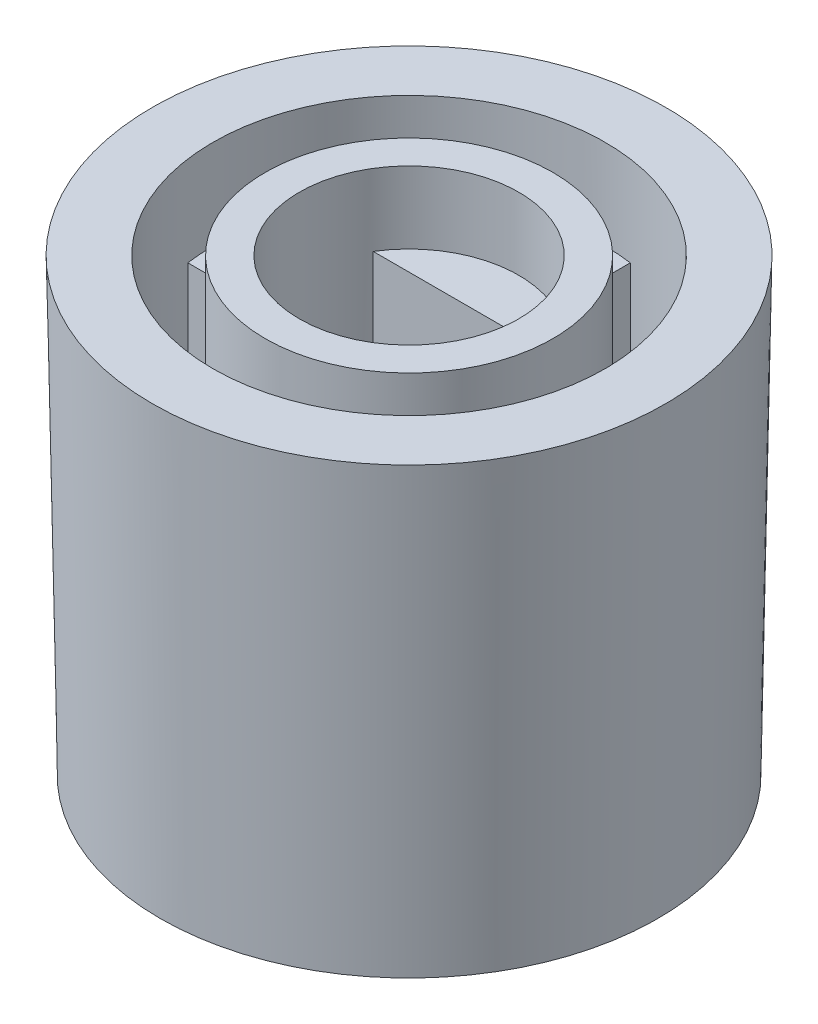
from build123d import *

# Parameters (mm, degrees)
SKETCH1_R           = 6.95
BOSS_EXTRUDE1_DEPTH = 2
SKETCH2_R           = 6.95
SKETCH2_R_2         = 5.45
BOSS_EXTRUDE2_DEPTH = 10.5
DRAFT1_ANGLE        = -1
SKETCH6_R           = 4
BOSS_EXTRUDE3_DEPTH = 10.5
CUT_EXTRUDE1_DEPTH  = 9
SKETCH7_R           = 3.05
CUT_EXTRUDE2_DEPTH  = 2
SKETCH8_W           = 2.525210291
SKETCH8_H           = 1.5
SKETCH8_W_2         = 2.122251202
SKETCH8_W_3         = 1.5
SKETCH8_H_2         = 2.337162717
SKETCH8_H_3         = 2.758031098
BOSS_EXTRUDE4_DEPTH = 8


with BuildPart() as part:
    # Sketch1 → Boss-Extrude1 (new body)
    with BuildSketch(Plane(origin=(0, 0, 0), x_dir=(1, 0, 0), z_dir=(0, 1, 0))):
        Circle(SKETCH1_R)
    extrude(amount=BOSS_EXTRUDE1_DEPTH)

    # Sketch2 → Boss-Extrude2 (add)
    with BuildSketch(Plane(origin=(0, 2, 0), x_dir=(1, 0, 0), z_dir=(0, 1, 0))):
        Circle(SKETCH2_R)
        Circle(SKETCH2_R_2, mode=Mode.SUBTRACT)
    extrude(amount=BOSS_EXTRUDE2_DEPTH)

    # Draft1
    draft1_faces = [part.faces().sort_by_distance(p)[0] for p in [
        (-6.95, 6.25, 0),
    ]]
    draft(draft1_faces, Plane.ZX.offset(2), DRAFT1_ANGLE)

    # Sketch6 → Boss-Extrude3 (add)
    with BuildSketch(Plane(origin=(0, 2, 0), x_dir=(1, 0, 0), z_dir=(0, 1, 0))):
        Circle(SKETCH6_R)
    extrude(amount=BOSS_EXTRUDE3_DEPTH)

    # Sketch5 → Cut-Extrude1 (cut)
    with BuildSketch(Plane(origin=(0, 12.5, 0), x_dir=(1, 0, 0), z_dir=(0, 1, 0))):
        with BuildLine():
            Line((2.596632435, 1.6), (-2.596632435, 1.6))
            ThreePointArc((-2.596632435, 1.6), (-0.831495964, -2.934470048), (3.05, 0))
            ThreePointArc((3.05, 0), (2.934470048, 0.831495964), (2.596632435, 1.6))
        make_face()
    extrude(amount=-CUT_EXTRUDE1_DEPTH, mode=Mode.SUBTRACT)

    # Sketch7 → Cut-Extrude2 (cut)
    with BuildSketch(Plane(origin=(0, 12.5, 0), x_dir=(1, 0, 0), z_dir=(0, 1, 0))):
        Circle(SKETCH7_R)
    extrude(amount=-CUT_EXTRUDE2_DEPTH, mode=Mode.SUBTRACT)

    # Sketch8 → Boss-Extrude4 (add)
    with BuildSketch(Plane(origin=(0, 2, 0), x_dir=(1, 0, 0), z_dir=(0, 1, 0))):
        with Locations((-4.853418362, 0)):
            Rectangle(SKETCH8_W, SKETCH8_H)
        with Locations((4.696712049, 0)):
            Rectangle(SKETCH8_W_2, SKETCH8_H)
        with Locations((0, 4.745962605)):
            Rectangle(SKETCH8_W_3, SKETCH8_H_2)
        with Locations((0, -4.822077099)):
            Rectangle(SKETCH8_W_3, SKETCH8_H_3)
    extrude(amount=BOSS_EXTRUDE4_DEPTH)


solid = part.part
